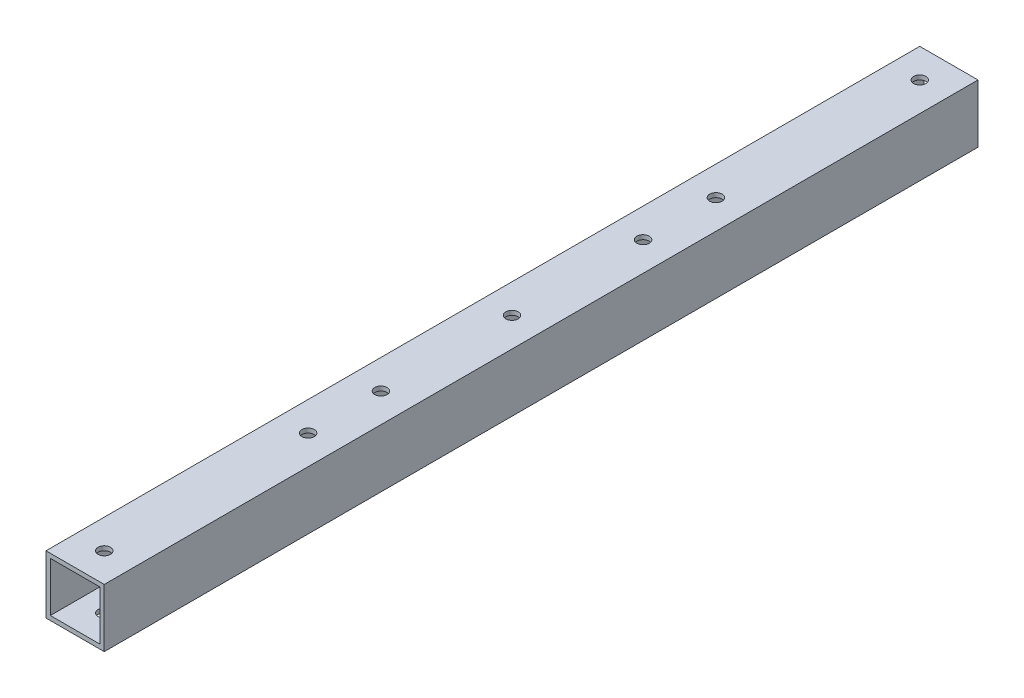
from build123d import *

# Parameters (mm, degrees)
SKETCH1_W           = 20
SKETCH1_H           = 20
SKETCH1_W_2         = 17
SKETCH1_H_2         = 17
BOSS_EXTRUDE1_DEPTH = 300
SKETCH2_R           = 2.125
CUT_EXTRUDE1_DEPTH  = 301.83217913


with BuildPart() as part:
    # Sketch1 → Boss-Extrude1 (new body)
    with BuildSketch(Plane.XY):
        Rectangle(SKETCH1_W, SKETCH1_H)
        Rectangle(SKETCH1_W_2, SKETCH1_H_2, mode=Mode.SUBTRACT)
    extrude(amount=-BOSS_EXTRUDE1_DEPTH)

    # Sketch2 → Cut-Extrude1 (cut, through all)
    with BuildSketch(Plane(origin=(0, 10, 0), x_dir=(1, 0, 0), z_dir=(0, 1, 0))):
        with Locations((0, 10)):
            Circle(SKETCH2_R)
        with Locations((0, 80)):
            Circle(SKETCH2_R)
        with Locations((0, 150)):
            Circle(SKETCH2_R)
        with Locations((0, 220)):
            Circle(SKETCH2_R)
        with Locations((0, 290)):
            Circle(SKETCH2_R)
        with Locations((0, 195)):
            Circle(SKETCH2_R)
        with Locations((0, 105)):
            Circle(SKETCH2_R)
    extrude(amount=-CUT_EXTRUDE1_DEPTH, mode=Mode.SUBTRACT)


solid = part.part
